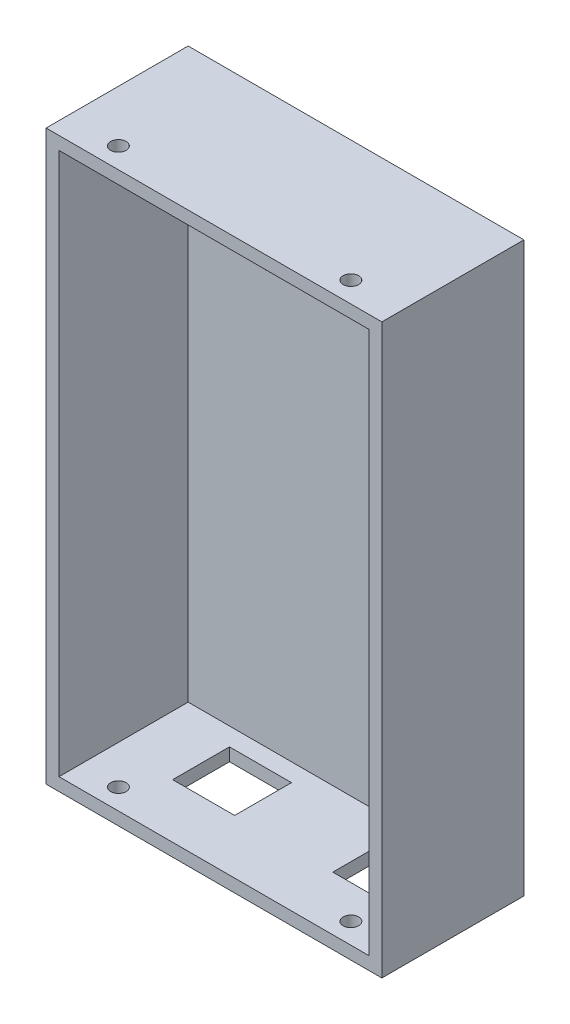
from build123d import *

# Parameters (mm, degrees)
SKETCH2_W           = 65
SKETCH2_H           = 110
BOSS_EXTRUDE1_DEPTH = 2.5
SKETCH3_W           = 65
SKETCH3_H           = 110
SKETCH3_W_2         = 60
SKETCH3_H_2         = 105
BOSS_EXTRUDE2_DEPTH = 25
SKETCH4_W           = 12
SKETCH4_H           = 11
SKETCH4_W_2         = 9.5
CUT_EXTRUDE3_DEPTH  = 17
SKETCH5_R           = 1.5
CUT_EXTRUDE4_DEPTH  = 118.951261121


with BuildPart() as part:
    # Sketch2 → Boss-Extrude1 (new body)
    with BuildSketch(Plane.XY):
        Rectangle(SKETCH2_W, SKETCH2_H)
    extrude(amount=BOSS_EXTRUDE1_DEPTH)

    # Sketch3 → Boss-Extrude2 (add)
    with BuildSketch(Plane.XY.offset(2.5)):
        Rectangle(SKETCH3_W, SKETCH3_H)
        Rectangle(SKETCH3_W_2, SKETCH3_H_2, mode=Mode.SUBTRACT)
    extrude(amount=BOSS_EXTRUDE2_DEPTH)

    # Sketch4 → Cut-Extrude3 (cut)
    with BuildSketch(Plane.XZ.offset(55)):
        with Locations((-12.5, 11.5)):
            Rectangle(SKETCH4_W, SKETCH4_H)
        with Locations((17.25, 11.5)):
            Rectangle(SKETCH4_W_2, SKETCH4_H)
    extrude(amount=-CUT_EXTRUDE3_DEPTH, mode=Mode.SUBTRACT)

    # Sketch5 → Cut-Extrude4 (cut, through all)
    with BuildSketch(Plane(origin=(0, -55, 0), x_dir=(-1, 0, 0), z_dir=(0, -1, 0))):
        with Locations((22.5, -23.5)):
            Circle(SKETCH5_R)
        with Locations((-22.5, -23.5)):
            Circle(SKETCH5_R)
    extrude(amount=-CUT_EXTRUDE4_DEPTH, mode=Mode.SUBTRACT)


solid = part.part
